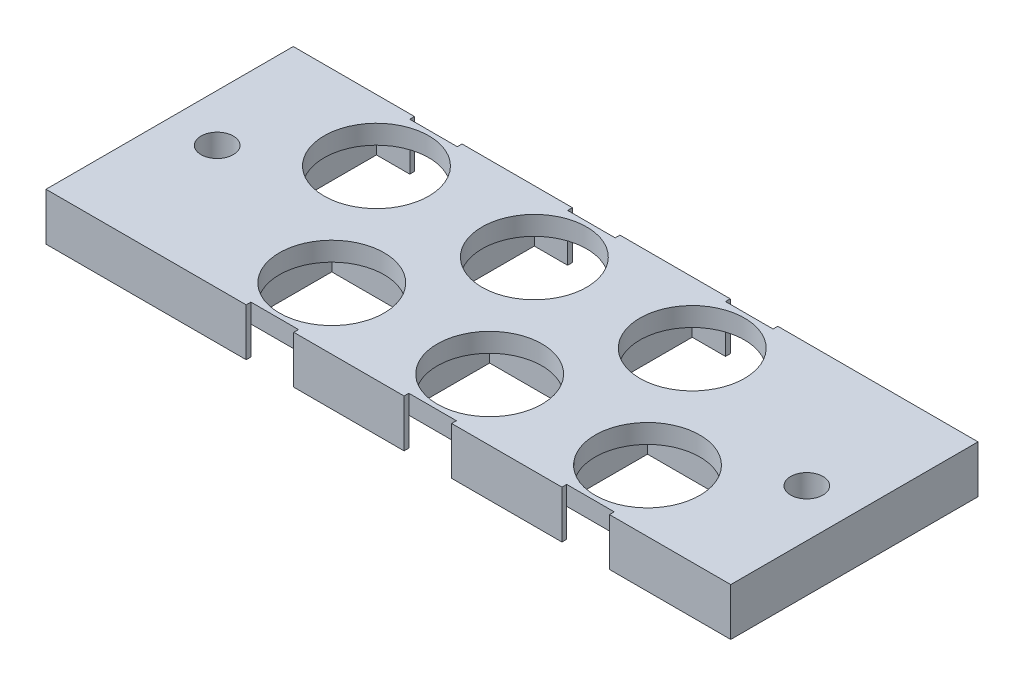
from build123d import *

# Parameters (mm, degrees)
SKETCH1_W             = 12
SKETCH1_H             = 12
SKETCH1_R             = 5.5
BOSS_EXTRUDE1_DEPTH   = 2
BOSS_EXTRUDE1_2_DEPTH = 2
BOSS_EXTRUDE1_3_DEPTH = 2
BOSS_EXTRUDE1_4_DEPTH = 2
BOSS_EXTRUDE1_5_DEPTH = 2
BOSS_EXTRUDE1_6_DEPTH = 2
SKETCH1_3_R           = 1.7
BOSS_EXTRUDE2_DEPTH   = 5
CUT_EXTRUDE1_DEPTH    = 1


with BuildPart() as part:
    # Sketch1 → Boss-Extrude1 (new body)
    with BuildSketch(Plane(origin=(0, 0, 0), x_dir=(1, 0, 0), z_dir=(0, 1, 0))):
        with Locations((11.886385948, -10.664884408)):
            Rectangle(SKETCH1_W, SKETCH1_H)
        with Locations((11.886385948, -10.664884408)):
            Circle(SKETCH1_R, mode=Mode.SUBTRACT)
    extrude(amount=-BOSS_EXTRUDE1_DEPTH)



with BuildPart() as body_2:
    # Sketch1 → Boss-Extrude1 2 (new body)
    with BuildSketch(Plane(origin=(0, 0, 0), x_dir=(1, 0, 0), z_dir=(0, 1, 0))):
        with Locations((-4.713614052, -10.664885052)):
            Rectangle(SKETCH1_W, SKETCH1_H)
        with Locations((-4.713614052, -10.664885052)):
            Circle(SKETCH1_R, mode=Mode.SUBTRACT)
    extrude(amount=-BOSS_EXTRUDE1_2_DEPTH)


with BuildPart() as body_3:
    # Sketch1 → Boss-Extrude1 3 (new body)
    with BuildSketch(Plane(origin=(0, 0, 0), x_dir=(1, 0, 0), z_dir=(0, 1, 0))):
        with Locations((3.586385956, -23.664883973)):
            Rectangle(SKETCH1_W, SKETCH1_H)
        with Locations((3.586385956, -23.664883973)):
            Circle(SKETCH1_R, mode=Mode.SUBTRACT)
    extrude(amount=-BOSS_EXTRUDE1_3_DEPTH)


with BuildPart() as body_4:
    # Sketch1 → Boss-Extrude1 4 (new body)
    with BuildSketch(Plane(origin=(0, 0, 0), x_dir=(1, 0, 0), z_dir=(0, 1, 0))):
        with Locations((20.186385956, -23.664884408)):
            Rectangle(SKETCH1_W, SKETCH1_H)
        with Locations((20.186385956, -23.664884408)):
            Circle(SKETCH1_R, mode=Mode.SUBTRACT)
    extrude(amount=-BOSS_EXTRUDE1_4_DEPTH)


with BuildPart() as body_5:
    # Sketch1 → Boss-Extrude1 5 (new body)
    with BuildSketch(Plane(origin=(0, 0, 0), x_dir=(1, 0, 0), z_dir=(0, 1, 0))):
        with Locations((28.486385948, -10.664884408)):
            Rectangle(SKETCH1_W, SKETCH1_H)
        with Locations((28.486385948, -10.664884408)):
            Circle(SKETCH1_R, mode=Mode.SUBTRACT)
    extrude(amount=-BOSS_EXTRUDE1_5_DEPTH)


with BuildPart() as body_6:
    # Sketch1 → Boss-Extrude1 6 (new body)
    with BuildSketch(Plane(origin=(0, 0, 0), x_dir=(1, 0, 0), z_dir=(0, 1, 0))):
        with Locations((36.786385956, -23.66488461)):
            Rectangle(SKETCH1_W, SKETCH1_H)
        with Locations((36.786385956, -23.66488461)):
            Circle(SKETCH1_R, mode=Mode.SUBTRACT)
    extrude(amount=-BOSS_EXTRUDE1_6_DEPTH)


with BuildPart() as part_1:
    add(part.part)

    add(body_2.part)  # Boss-Extrude2 merges body 2

    add(body_3.part)  # Boss-Extrude2 merges body 3

    add(body_4.part)  # Boss-Extrude2 merges body 4

    add(body_5.part)  # Boss-Extrude2 merges body 5

    add(body_6.part)  # Boss-Extrude2 merges body 6
    # Sketch1<3> → Boss-Extrude2 (add)
    with BuildSketch(Plane(origin=(0, 0, 0), x_dir=(1, 0, 0), z_dir=(0, 1, 0))):
        Polygon((5.386385948, -4.164884408), (1.786385948, -4.164885052), (-2.213614052, -4.164885052), (-2.213614052, -4.664885052), (1.286385948, -4.664885052), (1.286385948, -16.664885052), (-10.713614052, -16.664885052), (-10.713614052, -4.664885052), (-7.213614052, -4.664885052), (-7.213614052, -4.164885052), (-19.963614052, -4.164885052), (-19.963614052, -30.164883973), (1.086385956, -30.164883973), (1.086385956, -29.664883973), (-2.413614044, -29.664883973), (-2.413614044, -17.664883973), (9.586385956, -17.664883973), (9.586385956, -29.664883973), (6.086385956, -29.664883973), (6.086385956, -30.164883973), (10.086385956, -30.164883973), (13.686385956, -30.164884408), (17.686385956, -30.164884408), (17.686385956, -29.664884408), (14.186385956, -29.664884408), (14.186385956, -17.664884408), (26.186385956, -17.664884408), (26.186385956, -29.664884408), (22.686385956, -29.664884408), (22.686385956, -30.164884408), (26.686385956, -30.164884408), (30.286385956, -30.16488461), (34.286385956, -30.16488461), (34.286385956, -29.66488461), (30.786385956, -29.66488461), (30.786385956, -17.66488461), (42.786385956, -17.66488461), (42.786385956, -29.66488461), (39.286385956, -29.66488461), (39.286385956, -30.16488461), (43.286385956, -30.16488461), (52.036385956, -30.164883973), (52.036385956, -4.164885052), (34.986385948, -4.164884408), (30.986385948, -4.164884408), (30.986385948, -4.664884408), (34.486385948, -4.664884408), (34.486385948, -16.664884408), (22.486385948, -16.664884408), (22.486385948, -4.664884408), (25.986385948, -4.664884408), (25.986385948, -4.164884408), (14.386385948, -4.164884408), (14.386385948, -4.664884408), (17.886385948, -4.664884408), (17.886385948, -16.664884408), (5.886385948, -16.664884408), (5.886385948, -4.664884408), (9.386385948, -4.664884408), (9.386385948, -4.164884408), align=None)
        with Locations((-14.963614052, -17.164884513)):
            Circle(SKETCH1_3_R, mode=Mode.SUBTRACT)
        with Locations((47.036385956, -17.164884513)):
            Circle(SKETCH1_3_R, mode=Mode.SUBTRACT)
    extrude(amount=-BOSS_EXTRUDE2_DEPTH)

    # Sketch2 → Cut-Extrude1 (cut)
    # profile 1 of 2: a face of its own
    with BuildSketch(Plane(origin=(0, -5, 0), x_dir=(-1, 0, 0), z_dir=(0, -1, 0))):
        Polygon((8.920160293, -23.584386496), (10.466955165, -23.584386496), (10.466955165, -23.910027522), (9.205096191, -23.910027522), (9.205096191, -24.886950599), (10.466955165, -24.886950599), (10.466955165, -25.212591624), (9.205096191, -25.212591624), (9.205096191, -26.759386496), (8.920160293, -26.759386496), align=None)
    # profile 2 of 2: a face of its own
    with BuildSketch(Plane(origin=(0, -5, 0), x_dir=(-1, 0, 0), z_dir=(0, -1, 0))):
        with BuildLine():
            add(Edge.make_bspline(
                [(12.295505846, -24.990621472), (12.321494171, -25.004172332), (12.372180084, -25.030601035), (12.44436798, -25.073155857), (12.510339945, -25.118005875), (12.571926384, -25.163032691), (12.62804528, -25.209960689), (12.678069141, -25.25897648), (12.723233624, -25.308856588), (12.762627921, -25.360445657), (12.797277909, -25.413606632), (12.827224632, -25.468479044), (12.852821666, -25.524942639), (12.873108046, -25.583613764), (12.889819242, -25.643630572), (12.901317827, -25.705768027), (12.907501745, -25.769616679), (12.908670883, -25.812767924), (12.909262857, -25.834616865)],
                knots=[0, 0, 0, 0, 1.272397273, 2.481599622, 3.635517121, 4.734568067, 5.792894095, 6.808321871, 7.773003508, 8.711915296, 9.623354172, 10.525449501, 11.423591555, 12.311487226, 13.218079475, 14.126165749, 15.051214107, 16, 16, 16, 16], degree=3))
            add(Edge.make_bspline(
                [(12.909262857, -25.834616865), (12.908563069, -25.865185522), (12.907177925, -25.925692365), (12.895112939, -26.014997052), (12.877049023, -26.101730597), (12.850669751, -26.185873985), (12.816458318, -26.266962917), (12.774297188, -26.345066804), (12.726571309, -26.421465749), (12.688242492, -26.468473349), (12.668848194, -26.492259092)],
                knots=[0, 0, 0, 0, 1.025265484, 2.029385089, 3.018602448, 3.995076438, 4.983346944, 5.966715145, 6.97116228, 8, 8, 8, 8], degree=3))
            add(Edge.make_bspline(
                [(12.668848194, -26.492259092), (12.643596535, -26.520012016), (12.593405259, -26.575174913), (12.507423604, -26.646794576), (12.413060895, -26.706982955), (12.310682264, -26.756033888), (12.200561379, -26.794211774), (12.082721704, -26.821646059), (11.956933508, -26.837359976), (11.870477831, -26.839631453), (11.826124837, -26.840796753)],
                knots=[0, 0, 0, 0, 0.954267603, 1.896743057, 2.838368354, 3.796610408, 4.779680527, 5.799409237, 6.871065594, 8, 8, 8, 8], degree=3))
            add(Edge.make_bspline(
                [(11.826124837, -26.840796753), (11.783476977, -26.83975129), (11.700488574, -26.837716927), (11.579695356, -26.823933407), (11.467098, -26.799778128), (11.362041815, -26.766717661), (11.265160143, -26.723709811), (11.176729044, -26.670180755), (11.095472655, -26.608285089), (11.023856925, -26.536245175), (10.960276694, -26.459085534), (10.904425674, -26.379482288), (10.858003475, -26.297428171), (10.81869961, -26.214146681), (10.788611475, -26.128470527), (10.767772398, -26.040840515), (10.754537806, -25.951409707), (10.75277692, -25.891055993), (10.751891063, -25.860693588)],
                knots=[0, 0, 0, 0, 1.256902934, 2.445805442, 3.576955095, 4.645999104, 5.686449165, 6.692658513, 7.68621702, 8.689161843, 9.678783111, 10.630372946, 11.551080876, 12.453998257, 13.34127905, 14.221779781, 15.105423033, 16, 16, 16, 16], degree=3))
            add(Edge.make_bspline(
                [(10.751891063, -25.860693588), (10.752415283, -25.838414892), (10.753451328, -25.794384326), (10.760622155, -25.729333721), (10.772150545, -25.666018656), (10.787807338, -25.604205267), (10.80902634, -25.54434357), (10.83464599, -25.486149926), (10.864519975, -25.429558636), (10.899065032, -25.374260222), (10.939253297, -25.321029522), (10.984758893, -25.268963155), (11.036491317, -25.218869033), (11.09387505, -25.170135119), (11.156254311, -25.121896914), (11.225249357, -25.07676136), (11.299031157, -25.031533064), (11.351468918, -25.004492654), (11.378368426, -24.990621472)],
                knots=[0, 0, 0, 0, 0.941657376, 1.861047343, 2.762797495, 3.66048619, 4.553285746, 5.444104102, 6.34607688, 7.256116206, 8.197091036, 9.162375105, 10.176350973, 11.237807142, 12.343728897, 13.50695164, 14.721116704, 16, 16, 16, 16], degree=3))
            add(Edge.make_bspline(
                [(11.378368426, -24.990621472), (11.341546251, -24.970542075), (11.270248212, -24.931662742), (11.175842362, -24.860228139), (11.094752297, -24.782859907), (11.029206946, -24.697924307), (10.97761571, -24.608074643), (10.942220262, -24.513873071), (10.91827488, -24.417066311), (10.915902858, -24.350929975), (10.914711575, -24.317714821)],
                knots=[0, 0, 0, 0, 1.166880483, 2.259407225, 3.286803203, 4.280235371, 5.237608625, 6.161067461, 7.076446754, 8, 8, 8, 8], degree=3))
            add(Edge.make_bspline(
                [(10.914711575, -24.317714821), (10.916195139, -24.283880608), (10.91917736, -24.215867938), (10.943292229, -24.11462524), (10.982589718, -24.015187356), (11.03603948, -23.918036245), (11.102612168, -23.826459979), (11.182482964, -23.744326406), (11.273744526, -23.672379562), (11.375941305, -23.611985462), (11.48591989, -23.562833143), (11.601957726, -23.528925574), (11.722033044, -23.506758525), (11.803764547, -23.504248774), (11.845205365, -23.50297624)],
                knots=[0, 0, 0, 0, 0.888701115, 1.786444228, 2.72001202, 3.692817113, 4.693886446, 5.687152267, 6.695133018, 7.739871481, 8.800368666, 9.853104506, 10.91144658, 12, 12, 12, 12], degree=3))
            add(Edge.make_bspline(
                [(11.845205365, -23.50297624), (11.885576683, -23.50428828), (11.965184323, -23.506875473), (12.082200878, -23.528453569), (12.194164874, -23.564493919), (12.300690205, -23.6133864), (12.399869828, -23.67360884), (12.487501923, -23.746543918), (12.564910765, -23.828315182), (12.628940894, -23.919863679), (12.681702944, -24.016641484), (12.718443047, -24.117899056), (12.741985195, -24.221448559), (12.744954604, -24.291514463), (12.746442345, -24.326619068)],
                knots=[0, 0, 0, 0, 1.072916533, 2.115669174, 3.151510826, 4.193348718, 5.225979165, 6.227137561, 7.216255879, 8.211077061, 9.189680878, 10.138522389, 11.067357538, 12, 12, 12, 12], degree=3))
            add(Edge.make_bspline(
                [(12.746442345, -24.326619068), (12.745140993, -24.361069328), (12.742585213, -24.428727679), (12.721085982, -24.527358165), (12.684878905, -24.619725301), (12.635444914, -24.706877193), (12.57101465, -24.787233266), (12.492448157, -24.861815349), (12.400371816, -24.931236115), (12.331192298, -24.970412317), (12.295505846, -24.990621472)],
                knots=[0, 0, 0, 0, 0.975232327, 1.915300861, 2.843280834, 3.77672583, 4.742871857, 5.749627742, 6.839139064, 8, 8, 8, 8], degree=3))
        make_face()
        with BuildLine():
            add(Edge.make_bspline(
                [(11.829304925, -23.828617265), (11.807033837, -23.829208215), (11.76346185, -23.830364371), (11.699572984, -23.836404706), (11.638819479, -23.848155124), (11.580566575, -23.863793098), (11.525612938, -23.88491863), (11.473212235, -23.909769817), (11.424256284, -23.939983177), (11.378154102, -23.97387512), (11.336651614, -24.011152257), (11.299817485, -24.049990416), (11.269221267, -24.091152379), (11.243239689, -24.133614248), (11.224387884, -24.178636271), (11.210268837, -24.224838123), (11.200724432, -24.27280365), (11.200009249, -24.305584628), (11.199647473, -24.322166945)],
                knots=[0, 0, 0, 0, 1.203892937, 2.355340988, 3.463153438, 4.544400666, 5.610487187, 6.640501085, 7.674077295, 8.714426146, 9.728707835, 10.68524104, 11.601827946, 12.495867327, 13.368432065, 14.231010473, 15.105153427, 16, 16, 16, 16], degree=3))
            add(Edge.make_bspline(
                [(11.199647473, -24.322166945), (11.200271013, -24.338749979), (11.201503217, -24.371520435), (11.211032869, -24.419912757), (11.225235873, -24.46746667), (11.247597545, -24.513051425), (11.274418455, -24.558248329), (11.307521437, -24.60192779), (11.346972198, -24.644241817), (11.391447091, -24.68483051), (11.439898986, -24.722838674), (11.491228796, -24.755834346), (11.544792308, -24.783442432), (11.600039186, -24.80641982), (11.657532491, -24.824281406), (11.716919935, -24.836952964), (11.778211498, -24.844828776), (11.819741025, -24.845769502), (11.840753242, -24.846245471)],
                knots=[0, 0, 0, 0, 0.873023192, 1.725219244, 2.590779336, 3.480155217, 4.391973325, 5.357036234, 6.360879153, 7.436073238, 8.526419356, 9.601555421, 10.645666583, 11.697338044, 12.750135903, 13.812665442, 14.89329948, 16, 16, 16, 16], degree=3))
            add(Edge.make_bspline(
                [(11.840753242, -24.846245471), (11.867740836, -24.845453655), (11.92144947, -24.843877846), (12.000624292, -24.829226424), (12.077606834, -24.806179627), (12.151574268, -24.774647372), (12.220611999, -24.73507067), (12.282152633, -24.687687861), (12.335671243, -24.63359303), (12.380611653, -24.573628315), (12.415454871, -24.509809374), (12.442580082, -24.445764823), (12.458419899, -24.38081137), (12.460485978, -24.337298482), (12.461506447, -24.315806769)],
                knots=[0, 0, 0, 0, 1.076279235, 2.141928126, 3.20205304, 4.278698113, 5.344010996, 6.36967002, 7.368914609, 8.37248503, 9.349703398, 10.264243087, 11.142681841, 12, 12, 12, 12], degree=3))
            add(Edge.make_bspline(
                [(12.461506447, -24.315806769), (12.46102394, -24.300722765), (12.460066233, -24.270783179), (12.452174039, -24.226570519), (12.439133105, -24.183363682), (12.421477311, -24.140805737), (12.398245568, -24.099493787), (12.370700913, -24.058778414), (12.337241401, -24.019575543), (12.299688922, -23.980971581), (12.25710273, -23.945244645), (12.209564895, -23.913826015), (12.157319136, -23.887144806), (12.100364217, -23.865474293), (12.038909893, -23.849198018), (11.973239214, -23.837009331), (11.902804608, -23.830139437), (11.854336191, -23.829135661), (11.829304925, -23.828617265)],
                knots=[0, 0, 0, 0, 0.814439003, 1.616544685, 2.417341072, 3.248991801, 4.09997495, 4.973547432, 5.9003056, 6.880240646, 7.880314356, 8.896779544, 9.951930927, 11.043077905, 12.18215768, 13.381699519, 14.647792085, 16, 16, 16, 16], degree=3))
        make_face(mode=Mode.SUBTRACT)
        with BuildLine():
            add(Edge.make_bspline(
                [(11.847749436, -25.171886496), (11.819513902, -25.172388728), (11.764122674, -25.173373984), (11.68297246, -25.184340888), (11.605091375, -25.199607552), (11.530742004, -25.22276767), (11.459955744, -25.252881629), (11.392349397, -25.289107961), (11.328440158, -25.331930042), (11.269110542, -25.380803829), (11.21493295, -25.433472048), (11.167400206, -25.489226985), (11.127034598, -25.547032425), (11.094528721, -25.607622519), (11.067848078, -25.66971428), (11.050327632, -25.734854027), (11.039095651, -25.80178948), (11.037587407, -25.847291855), (11.03682696, -25.870233852)],
                knots=[0, 0, 0, 0, 1.140299081, 2.23698856, 3.303958914, 4.344563908, 5.37730929, 6.408454204, 7.439741482, 8.480804886, 9.510774543, 10.48932336, 11.43758569, 12.353841022, 13.263987381, 14.161954604, 15.073269652, 16, 16, 16, 16], degree=3))
            add(Edge.make_bspline(
                [(11.03682696, -25.870233852), (11.038063631, -25.898746174), (11.040517156, -25.955313955), (11.059981392, -26.038919026), (11.091219342, -26.119855269), (11.134785074, -26.197463112), (11.188730658, -26.26998928), (11.255066811, -26.333206955), (11.329670999, -26.389378582), (11.415067481, -26.43480878), (11.50834759, -26.471089827), (11.609486515, -26.496087022), (11.717032763, -26.512634623), (11.791291107, -26.514302116), (11.829304925, -26.515155727)],
                knots=[0, 0, 0, 0, 0.898778495, 1.783155532, 2.693654817, 3.627872908, 4.583023416, 5.533784346, 6.509005473, 7.520592997, 8.575161974, 9.658835044, 10.801527049, 12, 12, 12, 12], degree=3))
            add(Edge.make_bspline(
                [(11.829304925, -26.515155727), (11.859014187, -26.514585308), (11.916897357, -26.513473949), (12.001339611, -26.503663839), (12.081027166, -26.488106679), (12.15580549, -26.46547932), (12.226511687, -26.437856841), (12.291946944, -26.402322167), (12.353794608, -26.361906846), (12.409007062, -26.313956946), (12.459292902, -26.262721976), (12.503138103, -26.208483866), (12.541199596, -26.152716685), (12.571072677, -26.094160174), (12.59495435, -26.033937758), (12.612120717, -25.971494116), (12.622712713, -25.906637726), (12.623783954, -25.86264214), (12.62432696, -25.840341023)],
                knots=[0, 0, 0, 0, 1.224942928, 2.386581632, 3.501229538, 4.569074225, 5.605009692, 6.626002462, 7.634866581, 8.645888296, 9.63523824, 10.59253846, 11.518950513, 12.414518923, 13.29783783, 14.186679152, 15.080837789, 16, 16, 16, 16], degree=3))
            add(Edge.make_bspline(
                [(12.62432696, -25.840341023), (12.623505226, -25.818680864), (12.62188491, -25.775970815), (12.611600911, -25.712682608), (12.593534366, -25.651538627), (12.568744513, -25.591803264), (12.535741782, -25.534686873), (12.496875365, -25.478701489), (12.449981414, -25.425401), (12.396992845, -25.374371406), (12.339245073, -25.327185702), (12.277861306, -25.285444033), (12.213314044, -25.250290327), (12.145739874, -25.221700364), (12.075288841, -25.199214588), (12.002012764, -25.183506506), (11.92582585, -25.173619009), (11.874068931, -25.172470525), (11.847749436, -25.171886496)],
                knots=[0, 0, 0, 0, 0.917430815, 1.809013306, 2.70690318, 3.612392954, 4.541220862, 5.495268465, 6.494511384, 7.542276156, 8.608045339, 9.649016899, 10.681629292, 11.715607085, 12.752076957, 13.808767841, 14.885711793, 16, 16, 16, 16], degree=3))
        make_face(mode=Mode.SUBTRACT)
    extrude(amount=-CUT_EXTRUDE1_DEPTH, mode=Mode.SUBTRACT)


solid = part_1.part
